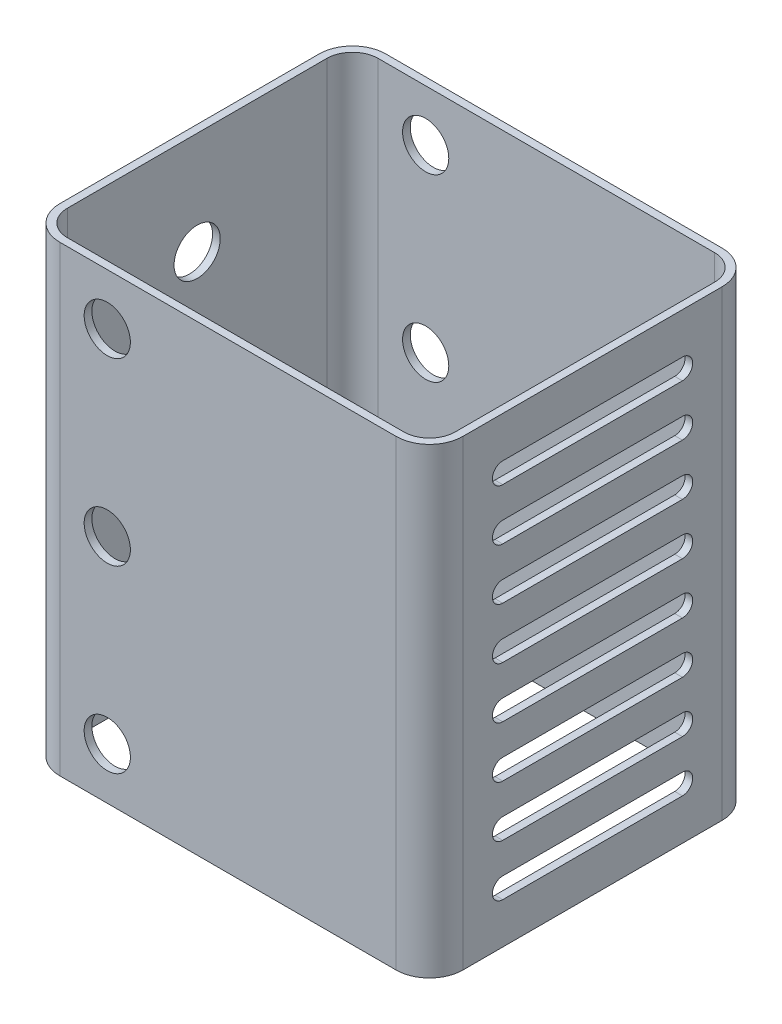
from build123d import *

# Parameters (mm, degrees)
BOSS_EXTRUDE1_DEPTH = 90
SKETCH2_R           = 4.5
CUT_EXTRUDE1_DEPTH  = 17
SKETCH3_R           = 4.5
CUT_EXTRUDE2_DEPTH  = 95
CUT_EXTRUDE3_DEPTH  = 29


with BuildPart() as part:
    # Sketch1 → Boss-Extrude1 (new body)
    with BuildSketch(Plane(origin=(0, 0, 0), x_dir=(1, 0, 0), z_dir=(0, 1, 0))):
        with BuildLine():
            Line((-32.75, -31.75), (32.75, -31.75))
            ThreePointArc((32.75, -31.75), (37.346194078, -29.846194078), (39.25, -25.25))
            Line((39.25, -25.25), (39.25, 25.25))
            ThreePointArc((39.25, 25.25), (37.346194078, 29.846194078), (32.75, 31.75))
            Line((32.75, 31.75), (-32.75, 31.75))
            ThreePointArc((-32.75, 31.75), (-37.346194078, 29.846194078), (-39.25, 25.25))
            Line((-39.25, 25.25), (-39.25, -25.25))
            ThreePointArc((-39.25, -25.25), (-37.346194078, -29.846194078), (-32.75, -31.75))
        make_face()
        with BuildLine():
            Line((-32.75, -30.25), (32.75, -30.25))
            ThreePointArc((32.75, -30.25), (36.285533906, -28.785533906), (37.75, -25.25))
            Line((37.75, -25.25), (37.75, 25.25))
            ThreePointArc((37.75, 25.25), (36.285533906, 28.785533906), (32.75, 30.25))
            Line((32.75, 30.25), (-32.75, 30.25))
            ThreePointArc((-32.75, 30.25), (-36.285533906, 28.785533906), (-37.75, 25.25))
            Line((-37.75, 25.25), (-37.75, -25.25))
            ThreePointArc((-37.75, -25.25), (-36.285533906, -28.785533906), (-32.75, -30.25))
        make_face(mode=Mode.SUBTRACT)
    extrude(amount=BOSS_EXTRUDE1_DEPTH)

    # Sketch2 → Cut-Extrude1 (cut)
    with BuildSketch(Plane.ZY.offset(34.75)):
        with Locations((0, 70)):
            Circle(SKETCH2_R)
        with Locations((0, 20)):
            Circle(SKETCH2_R)
    extrude(amount=CUT_EXTRUDE1_DEPTH, mode=Mode.SUBTRACT)

    # Sketch3 → Cut-Extrude2 (cut)
    with BuildSketch(Plane.XY.offset(32.25)):
        with Locations((-23.5, 80)):
            Circle(SKETCH3_R)
        with Locations((-23.5, 10)):
            Circle(SKETCH3_R)
        with Locations((-23.5, 45)):
            Circle(SKETCH3_R)
    extrude(amount=-CUT_EXTRUDE2_DEPTH, mode=Mode.SUBTRACT)

    # Sketch4 → Cut-Extrude3 (cut)
    with BuildSketch(Plane(origin=(34.75, 0, 0), x_dir=(0, 0, -1), z_dir=(1, 0, 0))):
        with BuildLine():
            Line((-17.5, 82), (17.5, 82))
            ThreePointArc((17.5, 82), (19.5, 80), (17.5, 78))
            Line((17.5, 78), (-17.5, 78))
            ThreePointArc((-17.5, 78), (-19.5, 80), (-17.5, 82))
        make_face()
        with BuildLine():
            Line((-17.5, 72), (17.5, 72))
            ThreePointArc((17.5, 72), (19.5, 70), (17.5, 68))
            Line((17.5, 68), (-17.5, 68))
            ThreePointArc((-17.5, 68), (-19.5, 70), (-17.5, 72))
        make_face()
        with BuildLine():
            Line((-17.5, 62), (17.5, 62))
            ThreePointArc((17.5, 62), (19.5, 60), (17.5, 58))
            Line((17.5, 58), (-17.5, 58))
            ThreePointArc((-17.5, 58), (-19.5, 60), (-17.5, 62))
        make_face()
        with BuildLine():
            Line((-17.5, 52), (17.5, 52))
            ThreePointArc((17.5, 52), (19.5, 50), (17.5, 48))
            Line((17.5, 48), (-17.5, 48))
            ThreePointArc((-17.5, 48), (-19.5, 50), (-17.5, 52))
        make_face()
        with BuildLine():
            Line((-17.5, 42), (17.5, 42))
            ThreePointArc((17.5, 42), (19.5, 40), (17.5, 38))
            Line((17.5, 38), (-17.5, 38))
            ThreePointArc((-17.5, 38), (-19.5, 40), (-17.5, 42))
        make_face()
        with BuildLine():
            Line((-17.5, 32), (17.5, 32))
            ThreePointArc((17.5, 32), (19.5, 30), (17.5, 28))
            Line((17.5, 28), (-17.5, 28))
            ThreePointArc((-17.5, 28), (-19.5, 30), (-17.5, 32))
        make_face()
        with BuildLine():
            Line((-17.5, 22), (17.5, 22))
            ThreePointArc((17.5, 22), (19.5, 20), (17.5, 18))
            Line((17.5, 18), (-17.5, 18))
            ThreePointArc((-17.5, 18), (-19.5, 20), (-17.5, 22))
        make_face()
        with BuildLine():
            Line((-17.5, 12), (17.5, 12))
            ThreePointArc((17.5, 12), (19.5, 10), (17.5, 8))
            Line((17.5, 8), (-17.5, 8))
            ThreePointArc((-17.5, 8), (-19.5, 10), (-17.5, 12))
        make_face()
    extrude(amount=CUT_EXTRUDE3_DEPTH, mode=Mode.SUBTRACT)


solid = part.part
